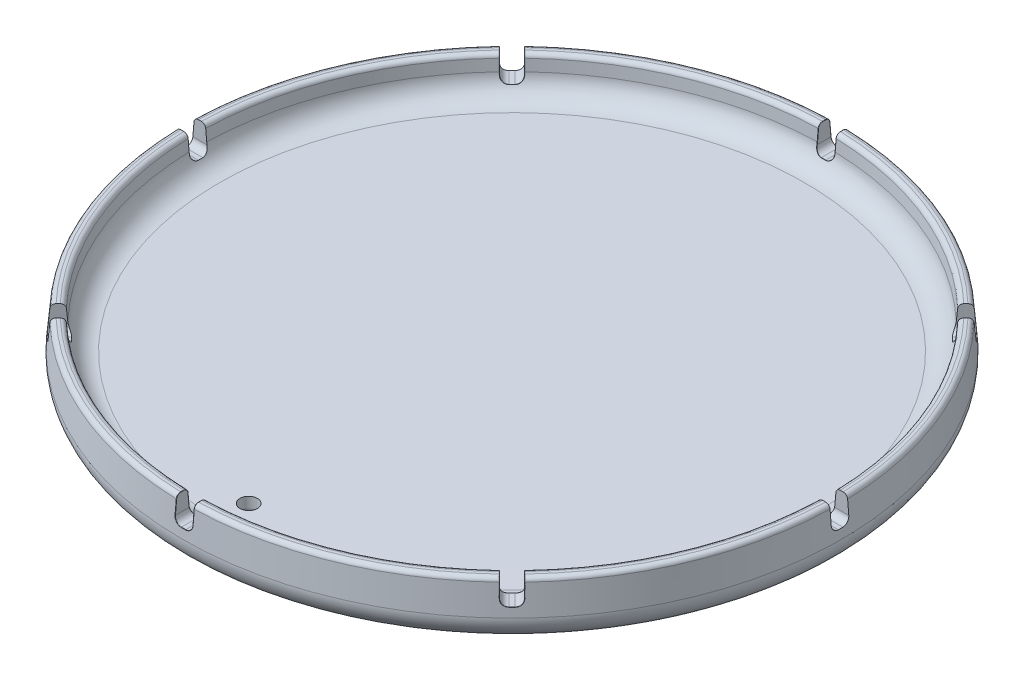
from build123d import *

# Parameters (mm, degrees)
SKETCH1_R           = 47.244
BOSS_EXTRUDE1_DEPTH = 3.175
SKETCH2_R           = 47.244
SKETCH2_R_2         = 45.6565
BOSS_EXTRUDE2_DEPTH = 5.08
DRAFT1_ANGLE        = 5.000000000000011
FILLET2_R           = 3.175
FILLET3_R           = 0.635
CUT_EXTRUDE1_START  = 1.5875
SKETCH3_W           = 2.54
SKETCH3_H           = 99.02926292629257
CUT_EXTRUDE1_DEPTH  = 67.43692733654677
CIRPATTERN1_COUNT   = 8
FILLET4_R           = 0.9524999999999999
FILLET5_R           = 0.03968749999999999
SKETCH5_R           = 1.2699999999999994
CUT_EXTRUDE3_DEPTH  = 69.33492050410698
FILLET9_R           = 3.175
FILLET10_R          = 1.5875


with BuildPart() as part:
    # Sketch1 → Boss-Extrude1 (new body)
    with BuildSketch(Plane(origin=(0, 0, 0), x_dir=(1, 0, 0), z_dir=(0, 1, 0))):
        with Locations(Location((0, 0, 0), (0, 0, 270))):
            Circle(SKETCH1_R)
    extrude(amount=BOSS_EXTRUDE1_DEPTH)

    # Sketch2 → Boss-Extrude2 (add)
    with BuildSketch(Plane(origin=(0, 3.175, 0), x_dir=(1, 0, 0), z_dir=(0, 1, 0))):
        with Locations(Location((0, 0, 0), (0, 0, 270))):
            Circle(SKETCH2_R)
        with Locations(Location((0, 0, 0), (0, 0, 270))):
            Circle(SKETCH2_R_2, mode=Mode.SUBTRACT)
    extrude(amount=BOSS_EXTRUDE2_DEPTH)

    # Draft1
    draft1_faces = [part.faces().sort_by_distance(p)[0] for p in [
        (1.398e-14, 5.715, -45.6565),
        (1.446e-14, 4.1274999999999995, -47.244),
    ]]
    draft(draft1_faces, Plane.ZX.offset(8.255), DRAFT1_ANGLE)

    # Fillet2
    fillet2_edges = [part.edges().sort_by_distance(p)[0] for p in [
        (1.384e-14, 3.175, -45.21205758928831),
    ]]
    fillet(fillet2_edges, radius=FILLET2_R)

    # Fillet3
    fillet3_edges = [part.edges().sort_by_distance(p)[0] for p in [
        (1.446e-14, 8.254999999999999, -47.24400000000001),
        (1.398e-14, 8.254999999999999, -45.6565),
    ]]
    fillet(fillet3_edges, radius=FILLET3_R)

    # Sketch3 → Cut-Extrude1 (cut, through all)
    with BuildSketch(Plane(origin=(0, 3.175, 0), x_dir=(1, 0, 0), z_dir=(0, 1, 0)).offset(CUT_EXTRUDE1_START)):
        Rectangle(SKETCH3_W, SKETCH3_H)
    cut_extrude1 = extrude(amount=CUT_EXTRUDE1_DEPTH, mode=Mode.SUBTRACT)

    # CirPattern1: Cut-Extrude1 ×8 about axis
    cirpattern1_axis = Axis((7.67e-15, 0, -9.88e-15), (0, 1, 0))
    for i in range(1, CIRPATTERN1_COUNT):
        add(cut_extrude1.rotate(cirpattern1_axis, i * 360 / CIRPATTERN1_COUNT), mode=Mode.SUBTRACT)

    # Fillet4
    fillet4_edges = [part.edges().sort_by_distance(p)[0] for p in [
        (33.62541075119196, 4.762499999999999, 31.829359526978124),
        (31.829359526978138, 4.762499999999999, 33.625410751191964),
        (46.283511924701756, 4.762499999999999, 1.270000000000003),
        (31.82935952697814, 4.762499999999999, -33.62541075119196),
        (46.28351192470176, 4.762499999999999, -1.2699999999999971),
        (33.62541075119197, 4.762499999999999, -31.82935952697813),
        (-31.82935952697813, 4.762499999999999, -33.62541075119197),
        (-33.625410751191964, 4.762499999999999, -31.829359526978138),
        (-46.28351192470176, 4.762499999999999, 1.2699999999999927),
        (-33.62541075119197, 4.762499999999999, 31.829359526978145),
        (-31.829359526978134, 4.762499999999999, 33.625410751191964),
        (-46.283511924701756, 4.762499999999999, -1.2700000000000073),
        (1.27, 4.762499999999999, -46.28351192470177),
        (1.27, 4.762499999999999, 46.28351192470176),
        (-1.27, 4.762499999999999, -46.28351192470176),
        (-1.27, 4.762499999999999, 46.28351192470177),
    ]]
    fillet(fillet4_edges, radius=FILLET4_R)

    # Fillet5
    fillet5_edges = [part.edges().sort_by_distance(p)[0] for p in [
        (33.08410624210461, 6.874312203062459, 31.288055017890773),
        (34.18434319776309, 8.088207097434273, 32.388291973549265),
        (32.388291973549265, 8.088207097434271, 34.184343197763084),
        (31.288055017890795, 6.874312203062686, 33.08410624210462),
        (32.59298645704583, 6.695171953170188, 34.389037681259666),
        (-32.388291973549244, 8.088207097434271, -34.184343197763084),
        (-31.288055017890773, 6.874312203062459, -33.08410624210461),
        (-32.59298645704582, 6.695171953170416, -34.38903768125966),
        (-33.08410624210462, 6.874312203062686, -31.288055017890795),
        (-34.18434319776308, 8.088207097434271, -32.388291973549265),
        (33.731033329018985, 8.254999999999999, 31.934982104805158),
        (31.93498210480516, 8.254999999999999, 33.731033329018985),
        (-33.73103332901898, 8.254999999999999, -31.934982104805165),
        (-31.934982104805147, 8.254999999999999, -33.731033329018985),
        (33.01973203276147, 5.89339694588641, 31.22368080854764),
        (-33.01973203276146, 5.893396945886411, -31.223680808547645),
        (-1.27, 6.695171953170302, 47.36344348579682),
        (-1.27, 6.695171953170302, -47.36344348579682),
        (1.27, 6.695171953170302, 47.36344348579682),
        (1.27, 6.695171953170302, -47.36344348579682),
        (0.15875098556665834, 4.762499999999999, 45.052057072389296),
        (0.15875088476267193, 4.762499999999999, 47.549289150529965),
        (1.27, 6.695171953170302, 47.36344348579682),
        (-1.27, 5.893396945886412, 45.426952866656606),
        (-31.856812837517513, 4.762499999999999, -31.856812837517502),
        (-33.62261218706928, 4.762499999999999, -33.62261218706929),
        (-31.22368080854763, 5.893396945886412, -33.01973203276147),
        (-34.38903768125966, 6.695171953170188, -32.59298645704584),
        (-1.103e-14, 4.762499999999999, -45.05233676879858),
        (-1.82e-14, 4.762499999999999, -47.54955415736429),
        (1.27, 5.893396945886413, -45.4269528666566),
        (-1.27, 6.695171953170302, -47.36344348579682),
        (31.85681283751752, 4.762499999999999, 31.8568128375175),
        (33.62261218706929, 4.762499999999999, 33.62261218706928),
        (34.38903768125966, 6.695171953170416, 32.59298645704582),
        (31.223680808547634, 5.893396945886413, 33.01973203276146),
        (0.9959616723786858, 5.0464597809779725, 45.1867975570367),
        (0.9917097313706007, 5.042172016034202, 47.51473785715284),
        (-0.9917097313706033, 5.0421720160342, 47.51473785715284),
        (-0.9959616718958865, 5.046459780925886, 45.186797557986296),
        (-32.896748661721205, 5.0421720043376155, -34.299238030047476),
        (-31.247639721356357, 5.046459780925886, -32.65614222535531),
        (-32.65614222502523, 5.046459780977968, -31.247639720343514),
        (-34.29923803004747, 5.042172004337615, -32.89674866172121),
        (0.9917097313705984, 5.042172016034205, -47.51473785715284),
        (0.9959616718958888, 5.046459780925889, -45.186797557986296),
        (-0.9959616723786804, 5.04645978097797, -45.1867975570367),
        (-0.9917097428855457, 5.04217200433761, -47.514737858270635),
        (32.65614222502523, 5.04645978097797, 31.24763972034351),
        (34.29923803004747, 5.042172004337613, 32.8967486617212),
        (32.896748669073105, 5.042172016034204, 34.29923802111478),
        (31.247639721356364, 5.046459780925888, 32.6561422253553),
        (1.27, 6.874312203062573, -45.51799174657672),
        (1.27, 6.874312203062573, -45.51799174657672),
        (1.27, 6.874312203062573, 45.51799174657672),
        (1.27, 8.088207097434271, 47.07396177109302),
        (1.27, 6.695171953170302, -47.36344348579682),
        (-1.27, 6.874312203062573, -45.51799174657672),
        (-1.27, 6.874312203062573, -45.51799174657672),
        (-1.27, 8.08820709743427, 47.07396177109302),
        (-1.27, 6.874312203062573, 45.51799174657672),
        (-1.27, 6.695171953170302, 47.36344348579682),
        (-1.27, 8.254999999999999, -46.43288480675754),
        (1.27, 8.254999999999999, -46.43288480675754),
        (1.27, 8.254999999999999, 46.43288480675754),
        (-1.27, 8.254999999999999, 46.43288480675754),
        (1.27, 5.893396945886411, 45.4269528666566),
        (-1.27, 5.893396945886412, -45.4269528666566),
        (-33.27772003164468, 8.088208052164642, -31.481668807430868),
        (-31.481668807430854, 8.088208052164635, -33.27772003164469),
        (31.481668807430857, 8.08820805216464, 33.277720031644684),
        (33.2777200316447, 8.088208052164639, 31.48166880743086),
    ]]
    fillet(fillet5_edges, radius=FILLET5_R)

    # Sketch5 → Cut-Extrude3 (cut, through all)
    with BuildSketch(Plane.XZ):
        with Locations(Location((0, 38.1, 0), (0, 0, 270))):
            Circle(SKETCH5_R)
    extrude(amount=-CUT_EXTRUDE3_DEPTH, mode=Mode.SUBTRACT)

    # Fillet9
    fillet9_edges = [part.edges().sort_by_distance(p)[0] for p in [
        (1.469e-14, 0, -47.96621891740651),
    ]]
    fillet(fillet9_edges, radius=FILLET9_R)

    # Fillet10
    fillet10_edges = [part.edges().sort_by_distance(p)[0] for p in [
        (3.9e-16, 0, 39.37),
    ]]
    fillet(fillet10_edges, radius=FILLET10_R)


solid = part.part
